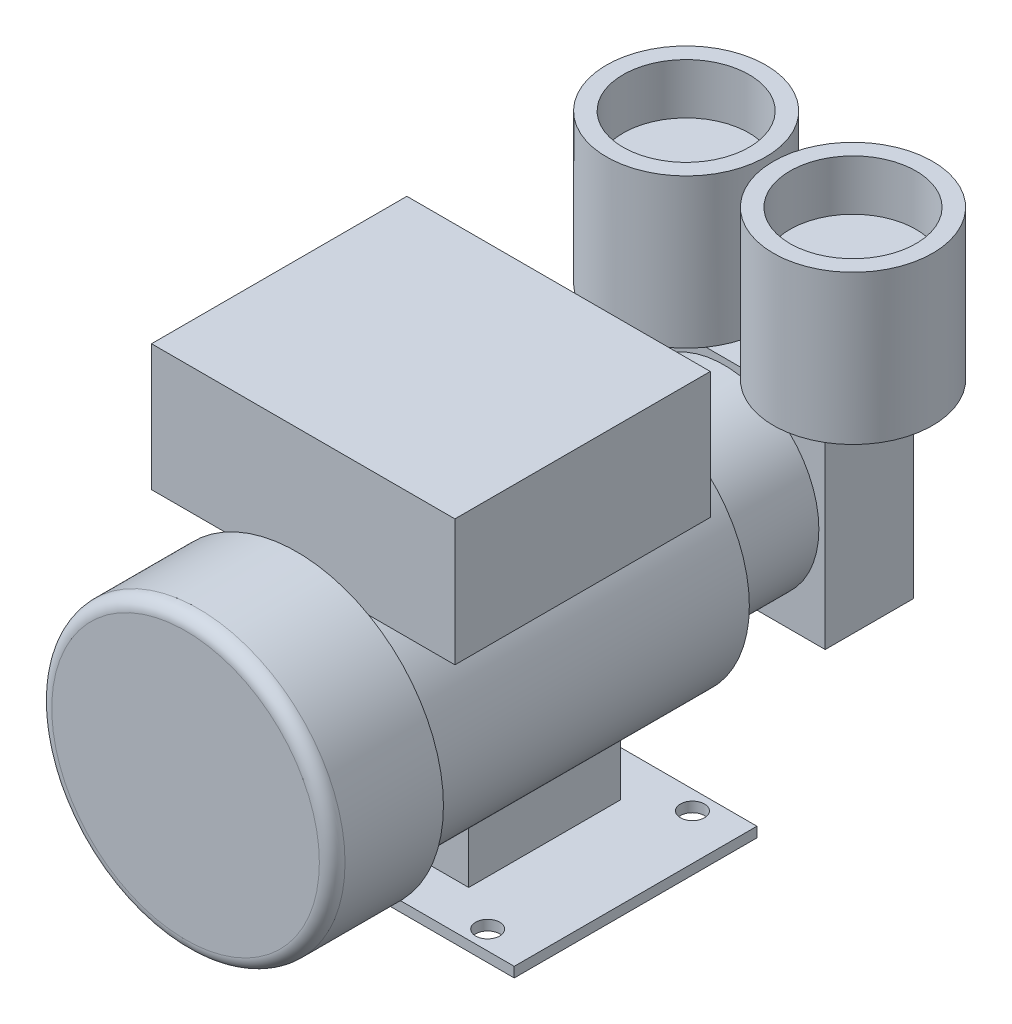
from build123d import *

# Parameters (mm, degrees)
SKETCH1_R              = 50
BOSS_EXTRUDE1_DEPTH    = 129
SKETCH2_W              = 132
SKETCH2_H              = 96
SKETCH2_R              = 4.75
BASE_PLATE_DEPTH       = 4
SKETCH3_R              = 37.5
MOTOR_PUMP_PLATE_DEPTH = 40
SKETCH18_W             = 101
SKETCH18_H             = 120
ELECTRICAL_BOX_DEPTH   = 50
SKETCH19_R             = 58
FAN_SHROUD_DEPTH       = 44
FILLET1_R              = 5.08
SKETCH20_W             = 80
SKETCH20_H             = 80
PUMP_HEAD_DEPTH        = 35
SKETCH21_W             = 60
SKETCH21_H             = 60
BOSS_EXTRUDE14_DEPTH   = 25
SKETCH23_R             = 31.5
BOSS_EXTRUDE15_DEPTH   = 59
SKETCH24_R             = 24.914163849
CUT_EXTRUDE1_DEPTH     = 20


with BuildPart() as part:
    # Sketch1 → Boss-Extrude1 (new body)
    with BuildSketch(Plane.XY):
        Circle(SKETCH1_R)
    extrude(amount=-BOSS_EXTRUDE1_DEPTH)

    # Sketch3 → Motor-pump-plate (add)
    with BuildSketch(Plane(origin=(0, 0, -129), x_dir=(-1, 0, 0), z_dir=(0, 0, -1))):
        Circle(SKETCH3_R)
    extrude(amount=MOTOR_PUMP_PLATE_DEPTH)

    # Sketch18 → Electrical_box (add)
    with BuildSketch(Plane(origin=(0, 48.000000012, 0), x_dir=(0, 0, -1), z_dir=(0, 1, 0))):
        with Locations((53.04, 0)):
            Rectangle(SKETCH18_W, SKETCH18_H)
    extrude(amount=ELECTRICAL_BOX_DEPTH)

    # Sketch19 → Fan_shroud (add)
    with BuildSketch(Plane.XY):
        Circle(SKETCH19_R)
    extrude(amount=FAN_SHROUD_DEPTH)

    # Fillet1
    fillet1_edges = [part.edges().sort_by_distance(p)[0] for p in [
        (-58, 0, 44),
    ]]
    fillet(fillet1_edges, radius=FILLET1_R)

    # Sketch20 → Pump_head (add)
    with BuildSketch(Plane(origin=(0, 0, -169), x_dir=(-1, 0, 0), z_dir=(0, 0, -1))):
        Rectangle(SKETCH20_W, SKETCH20_H)
    extrude(amount=PUMP_HEAD_DEPTH)



with BuildPart() as body_2:
    # Sketch2 → Base_plate (new body)
    with BuildSketch(Plane(origin=(0, -65, 0), x_dir=(-1, 0, 0), z_dir=(0, 1, 0))):
        with Locations((0, -68)):
            Rectangle(SKETCH2_W, SKETCH2_H)
        with Locations((-48, -108.5)):
            Circle(SKETCH2_R, mode=Mode.SUBTRACT)
        with Locations((48, -108.5)):
            Circle(SKETCH2_R, mode=Mode.SUBTRACT)
        with Locations((-48, -27.5)):
            Circle(SKETCH2_R, mode=Mode.SUBTRACT)
        with Locations((48, -27.5)):
            Circle(SKETCH2_R, mode=Mode.SUBTRACT)
    extrude(amount=BASE_PLATE_DEPTH)


with BuildPart() as part_1:
    add(part.part)

    add(body_2.part)  # Boss-Extrude14 merges body 2
    # Sketch21 → Boss-Extrude14 (add)
    with BuildSketch(Plane(origin=(0, -61, 0), x_dir=(1, 0, 0), z_dir=(0, 1, 0))):
        with Locations((0, 68)):
            Rectangle(SKETCH21_W, SKETCH21_H)
    extrude(amount=BOSS_EXTRUDE14_DEPTH)

    # Sketch23 → Boss-Extrude15 (add)
    with BuildSketch(Plane(origin=(0, 40, 0), x_dir=(1, 0, 0), z_dir=(0, 1, 0))):
        with Locations((33, 187)):
            Circle(SKETCH23_R)
        with Locations((-33, 187)):
            Circle(SKETCH23_R)
    extrude(amount=BOSS_EXTRUDE15_DEPTH)

    # Sketch24 → Cut-Extrude1 (cut)
    with BuildSketch(Plane(origin=(0, 99, 0), x_dir=(1, 0, 0), z_dir=(0, 1, 0))):
        with Locations((33, 187)):
            Circle(SKETCH24_R)
        with Locations((-33, 187)):
            Circle(SKETCH24_R)
    extrude(amount=-CUT_EXTRUDE1_DEPTH, mode=Mode.SUBTRACT)


solid = part_1.part
